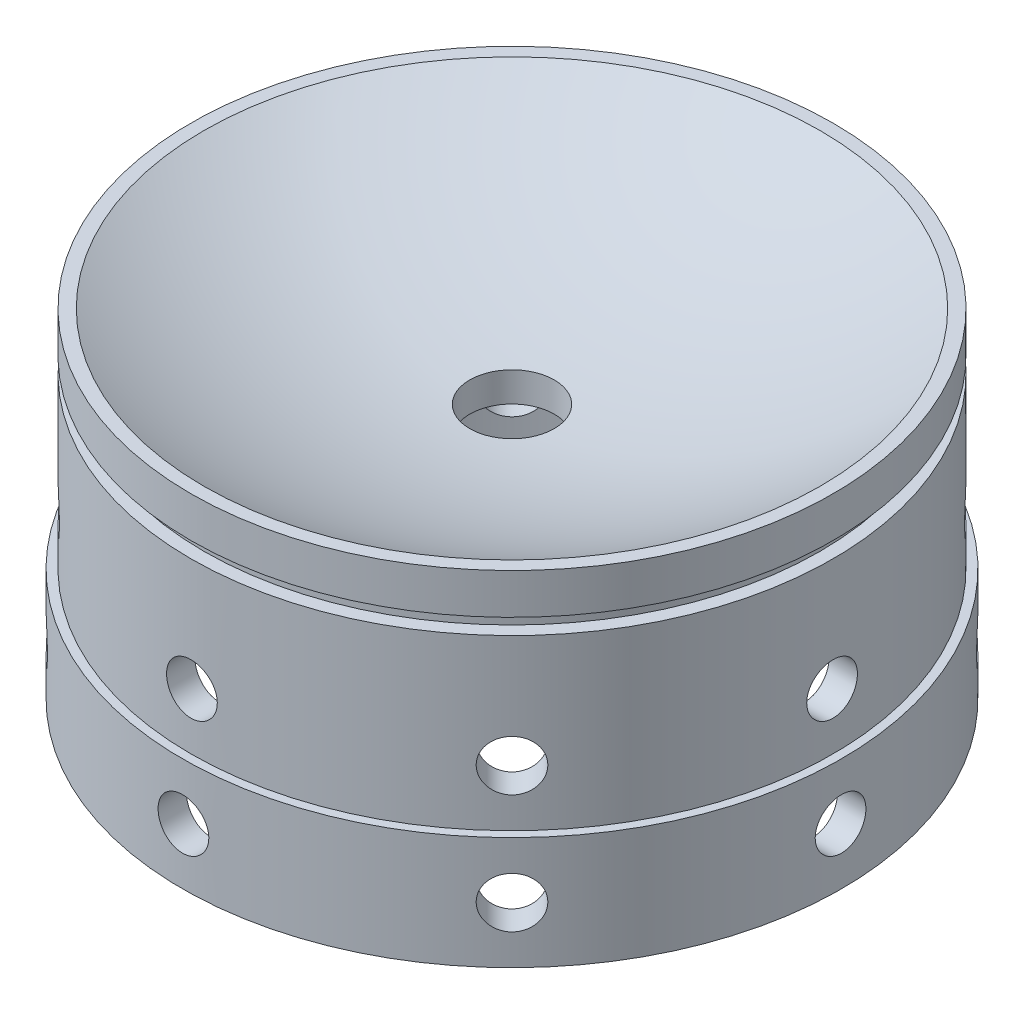
from build123d import *

# Parameters (mm, degrees)
CHAMFER1_SIZE     = 2.54
CIRPATTERN1_COUNT = 8


with BuildPart() as part:
    # Sketch1 → Revolve1 (revolve)
    with BuildSketch(Plane.XY, mode=Mode.PRIVATE) as revolve1_sk:
        with BuildLine():
            Line((9.525, 6.683492719), (9.525, 0))
            Line((9.525, 0), (66.04, 0))
            Line((66.04, 0), (72.39, 0))
            Line((72.39, 0), (72.39, 12.7))
            Line((72.39, 12.7), (69.469, 12.7))
            Line((69.469, 12.7), (69.469, 16.256))
            Line((69.469, 16.256), (72.39, 16.256))
            Line((72.39, 16.256), (72.39, 25.4))
            Line((72.39, 25.4), (69.469, 25.4))
            ThreePointArc((69.469, 25.4), (40.590515151, 12.53950787), (9.525, 6.683492719))
        make_face()
        Polygon((72.39, 0), (66.04, 0), (66.04, -25.4), (67.945, -25.4), (72.39, -25.4), align=None)
        Polygon((74.295, -25.4), (72.39, -25.4), (67.945, -25.4), (67.945, -50.8), (74.295, -50.8), align=None)
    revolve(revolve1_sk.sketch.rotate(Axis((0, 0, 0), (0, 1, 0)), 90), axis=Axis((0, 0, 0), (0, 1, 0)))

    # Sketch8 → 1/2 (0.45) Diameter Hole1 (revolve, cut)
    with BuildSketch(Plane(origin=(72.39, -12.7, 0), x_dir=(0, 0, -1), z_dir=(0, 1, 0))):
        Polygon((0, 0), (0, 75.822918438), (5.715, 72.389), (5.715, 0), align=None)
    f_1_2_0_45_diameter_hole1 = revolve(axis=Axis((78.74, -12.7, 0), (-1, 0, 0)), mode=Mode.SUBTRACT)

    # Sketch9 → 1/2 (0.45) Diameter Hole2 (revolve, cut)
    with BuildSketch(Plane(origin=(74.295, -38.1, 0), x_dir=(0, 0, -1), z_dir=(0, 1, 0))):
        Polygon((0, 0), (0, 77.727918438), (5.715, 74.294), (5.715, 0), align=None)
    f_1_2_0_45_diameter_hole2 = revolve(axis=Axis((80.645, -38.1, 0), (-1, 0, 0)), mode=Mode.SUBTRACT)

    # Chamfer1
    # the kernel refuses this chamfer: 2.54 mm, written as the material it adds along each edge
    with BuildSketch(Plane(origin=(0, -25.4, 0), x_dir=(0, 0, -1), z_dir=(1, 0, 0))) as chamfer1_piece_1_section:
        Polygon((67.945, -CHAMFER1_SIZE), (67.945 - CHAMFER1_SIZE, 0), (67.945, 0), align=None)
    chamfer1_piece_1 = revolve(axis=Axis((0, -25.4, 0), (0, 1, 0)), mode=Mode.PRIVATE)
    chamfer1_piece_1 = chamfer1_piece_1 - Plane(origin=(0, -26.944579126, 0), x_dir=(0, 0, -1), z_dir=(0, -1, 0)) * Cylinder(66.04, 272, mode=Mode.PRIVATE)
    add(chamfer1_piece_1)

    # CirPattern1: 1/2 (0.45) Diameter Hole1, 1/2 (0.45) Diameter Hole2 ×8 about axis
    cirpattern1_axis = Axis((0, -25.4, 0), (0, -1, 0))
    add([f_1_2_0_45_diameter_hole1.rotate(cirpattern1_axis, i * 360 / CIRPATTERN1_COUNT) for i in range(1, CIRPATTERN1_COUNT)], mode=Mode.SUBTRACT)
    add([f_1_2_0_45_diameter_hole2.rotate(cirpattern1_axis, i * 360 / CIRPATTERN1_COUNT) for i in range(1, CIRPATTERN1_COUNT)], mode=Mode.SUBTRACT)


solid = part.part
